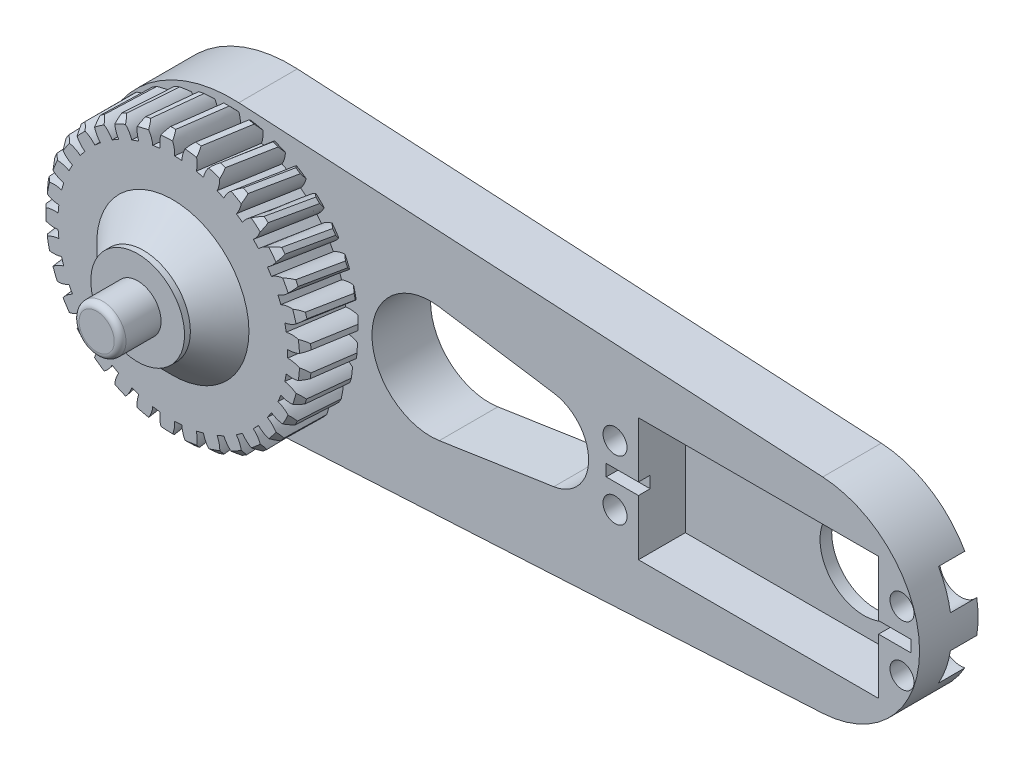
from build123d import *

# Parameters (mm, degrees)
SKETCH5_R           = 22.65
BOSS_EXTRUDE1_DEPTH = 10
CHAMFER1_SIZE       = 1
CUT_SWEEP1_PITCH    = 1030.927835052
CUT_SWEEP1_HEIGHT   = 20
CUT_SWEEP1_RADIUS   = 22.65
CIRPATTERN1_COUNT   = 33
BOSS_EXTRUDE2_START = 10
SKETCH11_R          = 8
BOSS_EXTRUDE2_DEPTH = 6
BOSS_EXTRUDE3_START = 16
SKETCH12_R          = 4
BOSS_EXTRUDE3_DEPTH = 7
FILLET1_R           = 1
CHAMFER3_SIZE       = 5
SKETCH13_R          = 5
BOSS_EXTRUDE5_DEPTH = 10
CUT_EXTRUDE1_START  = -10
SKETCH14_R          = 7.5
CUT_EXTRUDE1_DEPTH  = 7.1
SKETCH15_R          = 2.05
CUT_EXTRUDE2_DEPTH  = 10
SKETCH17_W          = 21
SKETCH17_H          = 41
CUT_EXTRUDE3_DEPTH  = 8
SKETCH18_W          = 2
SKETCH18_H          = 52
CUT_EXTRUDE4_DEPTH  = 2
CUT_EXTRUDE5_START  = -10
SKETCH19_R          = 3.6
CUT_EXTRUDE5_DEPTH  = 4.5


with BuildPart() as part:
    # Sketch5 → Boss-Extrude1 (new body)
    with BuildSketch(Plane(origin=(0, 0, 0), x_dir=(0, 1, 0), z_dir=(0, 0, 1))):
        with Locations(Location((0, 0, 0), (0, 0, 270))):
            Circle(SKETCH5_R)
    extrude(amount=BOSS_EXTRUDE1_DEPTH)

    # Chamfer1
    chamfer1_edges = [part.edges().sort_by_distance(p)[0] for p in [
        (-22.65, 0, 0),
        (-22.65, 0, 10),
    ]]
    chamfer(chamfer1_edges, length=CHAMFER1_SIZE)

    # Cut-Sweep1: sweep along a helix
    with BuildLine() as cut_sweep1_path:
        Helix(CUT_SWEEP1_PITCH, CUT_SWEEP1_HEIGHT, CUT_SWEEP1_RADIUS, center=(0, 0, 10), direction=(0, 0, -1))
    # Sketch10 → Cut-Sweep1 (sweep, cut)
    with BuildSketch(Plane.XY.offset(10)):
        with BuildLine():
            Line((19.60611299, 0.64), (19.60611299, -0.64))
            ThreePointArc((19.60611299, -0.64), (21.198135164, -0.883182944), (22.58611299, -1.7))
            ThreePointArc((22.58611299, -1.7), (22.65, 0), (22.58611299, 1.7))
            ThreePointArc((22.58611299, 1.7), (21.198135164, 0.883182944), (19.60611299, 0.64))
        make_face()
    cut_sweep1 = sweep(path=cut_sweep1_path.line, is_frenet=True, mode=Mode.SUBTRACT)

    # CirPattern1: Cut-Sweep1 ×33 about axis
    cirpattern1_axis = Axis((0, 0, 10), (0, 0, -1))
    for i in range(1, CIRPATTERN1_COUNT):
        add(cut_sweep1.rotate(cirpattern1_axis, i * 360 / CIRPATTERN1_COUNT), mode=Mode.SUBTRACT)

    # Sketch11 → Boss-Extrude2 (add)
    with BuildSketch(Plane(origin=(0, 0, 0), x_dir=(0, 1, 0), z_dir=(0, 0, 1)).offset(BOSS_EXTRUDE2_START)):
        with Locations(Location((0, 0, 0), (0, 0, 270))):
            Circle(SKETCH11_R)
    extrude(amount=BOSS_EXTRUDE2_DEPTH)

    # Sketch12 → Boss-Extrude3 (add)
    with BuildSketch(Plane(origin=(0, 0, 0), x_dir=(0, 1, 0), z_dir=(0, 0, 1)).offset(BOSS_EXTRUDE3_START)):
        with Locations(Location((0, 0, 0), (0, 0, 270))):
            Circle(SKETCH12_R)
    extrude(amount=BOSS_EXTRUDE3_DEPTH)

    # Fillet1
    fillet1_edges = [part.edges().sort_by_distance(p)[0] for p in [
        (-4, 0, 23),
    ]]
    fillet(fillet1_edges, radius=FILLET1_R)

    # Chamfer3
    chamfer3_edges = [part.edges().sort_by_distance(p)[0] for p in [
        (-8, 0, 10),
    ]]
    chamfer(chamfer3_edges, length=CHAMFER3_SIZE)

    # Sketch13 → Boss-Extrude5 (add)
    with BuildSketch(Plane(origin=(0, 0, 0), x_dir=(0, 1, 0), z_dir=(0, 0, 1))):
        with BuildLine():
            Line((-17.473511203, -100.9625), (-22.965186152, -1.265))
            ThreePointArc((-22.965186152, -1.265), (0, 23), (22.965186152, -1.265))
            Line((22.965186152, -1.265), (17.473511203, -100.9625))
            ThreePointArc((17.473511203, -100.9625), (0, -117.5), (-17.473511203, -100.9625))
        make_face()
        with Locations(Location((0, -100, 0), (0, 0, 270))):
            Circle(SKETCH13_R, mode=Mode.SUBTRACT)
        with BuildLine():
            Line((-9.886859967, -35.5), (-6.920801977, -55.05))
            ThreePointArc((-6.920801977, -55.05), (0, -61), (6.920801977, -55.05))
            Line((6.920801977, -55.05), (9.886859967, -35.5))
            ThreePointArc((9.886859967, -35.5), (0, -24), (-9.886859967, -35.5))
        make_face(mode=Mode.SUBTRACT)
    extrude(amount=-BOSS_EXTRUDE5_DEPTH)

    # Sketch14 → Cut-Extrude1 (cut)
    with BuildSketch(Plane(origin=(0, 0, 0), x_dir=(0, 1, 0), z_dir=(0, 0, 1)).offset(CUT_EXTRUDE1_START)):
        with Locations(Location((0, -100, 0), (0, 0, 270))):
            Circle(SKETCH14_R)
    extrude(amount=CUT_EXTRUDE1_DEPTH, mode=Mode.SUBTRACT)

    # Sketch15 → Cut-Extrude2 (cut)
    with BuildSketch(Plane(origin=(0, 0, 0), x_dir=(0, 1, 0), z_dir=(0, 0, 1))):
        with Locations(Location((5.1, -114.5, 0), (0, 0, 270))):
            Circle(SKETCH15_R)
        with Locations(Location((-5.1, -114.5, 0), (0, 0, 90))):
            Circle(SKETCH15_R)
        with Locations(Location((5.1, -65.5, 0), (0, 0, 90))):
            Circle(SKETCH15_R)
        with Locations(Location((-5.1, -65.5, 0), (0, 0, 270))):
            Circle(SKETCH15_R)
    extrude(amount=-CUT_EXTRUDE2_DEPTH, mode=Mode.SUBTRACT)

    # Sketch17 → Cut-Extrude3 (cut)
    with BuildSketch(Plane(origin=(0, 0, 0), x_dir=(0, 1, 0), z_dir=(0, 0, 1))):
        with Locations((0, -90)):
            Rectangle(SKETCH17_W, SKETCH17_H)
    extrude(amount=-CUT_EXTRUDE3_DEPTH, mode=Mode.SUBTRACT)

    # Sketch18 → Cut-Extrude4 (cut)
    with BuildSketch(Plane(origin=(0, 0, 0), x_dir=(0, 1, 0), z_dir=(0, 0, 1))):
        with Locations((0, -90)):
            Rectangle(SKETCH18_W, SKETCH18_H)
    extrude(amount=-CUT_EXTRUDE4_DEPTH, mode=Mode.SUBTRACT)

    # Sketch19 → Cut-Extrude5 (cut)
    with BuildSketch(Plane(origin=(0, 0, 0), x_dir=(0, 1, 0), z_dir=(0, 0, 1)).offset(CUT_EXTRUDE5_START)):
        with Locations(Location((5.1, -65.5, 0), (0, 0, 270))):
            Circle(SKETCH19_R)
        with Locations(Location((-5.1, -65.5, 0), (0, 0, 270))):
            Circle(SKETCH19_R)
        with Locations((5.1, -114.5)):
            Circle(SKETCH19_R)
        with Locations((-5.1, -114.5)):
            Circle(SKETCH19_R)
    extrude(amount=CUT_EXTRUDE5_DEPTH, mode=Mode.SUBTRACT)


solid = part.part
